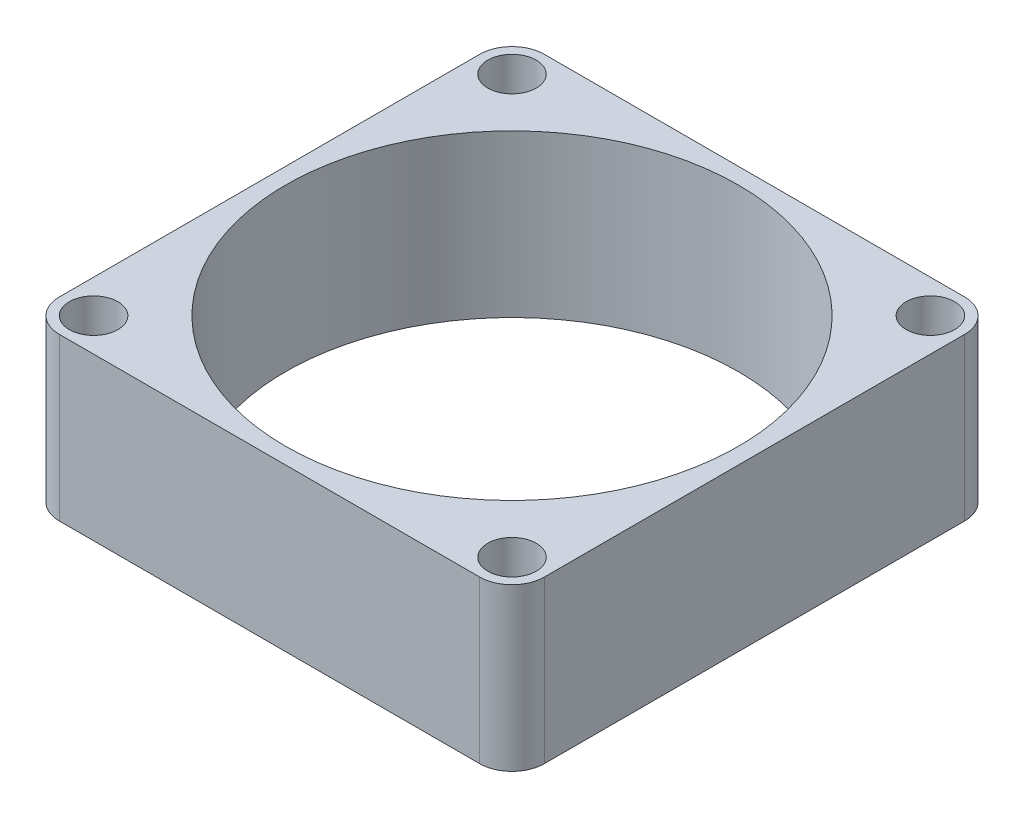
from build123d import *

# Parameters (mm, degrees)
SCHIZZO1_W                   = 30
SCHIZZO1_H                   = 30
ESTRUSIONE_ESTRUSIONE1_DEPTH = 10
SCHIZZO2_R                   = 1.5
TAGLIO_ESTRUSIONE1_DEPTH     = 24.452078799
SCHIZZO2_3_R                 = 1.5
TAGLIO_ESTRUSIONE2_DEPTH     = 24.452078799
RACCORDO2_R                  = 2
RACCORDO3_R                  = 2
SCHIZZO3D1_R                 = 14
TAGLIO_ESTRUSIONE4_DEPTH     = 27


with BuildPart() as part:
    # Schizzo1 → Estrusione-Estrusione1 (new body)
    with BuildSketch(Plane(origin=(0, 0, 0), x_dir=(1, 0, 0), z_dir=(0, 1, 0))):
        Rectangle(SCHIZZO1_W, SCHIZZO1_H)
    extrude(amount=ESTRUSIONE_ESTRUSIONE1_DEPTH)

    # Schizzo2 → Taglio-Estrusione1 (cut, through all)
    with BuildSketch(Plane(origin=(0, 10, 0), x_dir=(1, 0, 0), z_dir=(0, 1, 0))):
        with Locations((-12.93949084, 12.93949084)):
            Circle(SCHIZZO2_R)
    extrude(amount=-TAGLIO_ESTRUSIONE1_DEPTH, mode=Mode.SUBTRACT)

    # Schizzo2<3> → Taglio-Estrusione2 (cut, through all)
    with BuildSketch(Plane(origin=(0, 10, 0), x_dir=(1, 0, 0), z_dir=(0, 1, 0))):
        with Locations((12.93949084, -12.93949084)):
            Circle(SCHIZZO2_3_R)
        with Locations((-12.93949084, -12.93949084)):
            Circle(SCHIZZO2_3_R)
        with Locations((12.93949084, 12.93949084)):
            Circle(SCHIZZO2_3_R)
    extrude(amount=-TAGLIO_ESTRUSIONE2_DEPTH, mode=Mode.SUBTRACT)

    # Raccordo2
    raccordo2_edges = [part.edges().sort_by_distance(p)[0] for p in [
        (-15, 5, -15),
    ]]
    fillet(raccordo2_edges, radius=RACCORDO2_R)

    # Raccordo3
    raccordo3_edges = [part.edges().sort_by_distance(p)[0] for p in [
        (15, 5, -15),
        (15, 5, 15),
        (-15, 5, 15),
    ]]
    fillet(raccordo3_edges, radius=RACCORDO3_R)

    # Schizzo3D1 → Taglio-Estrusione4 (cut)
    with BuildSketch(Plane.ZX):
        Circle(SCHIZZO3D1_R)
    extrude(amount=TAGLIO_ESTRUSIONE4_DEPTH, mode=Mode.SUBTRACT)


solid = part.part
